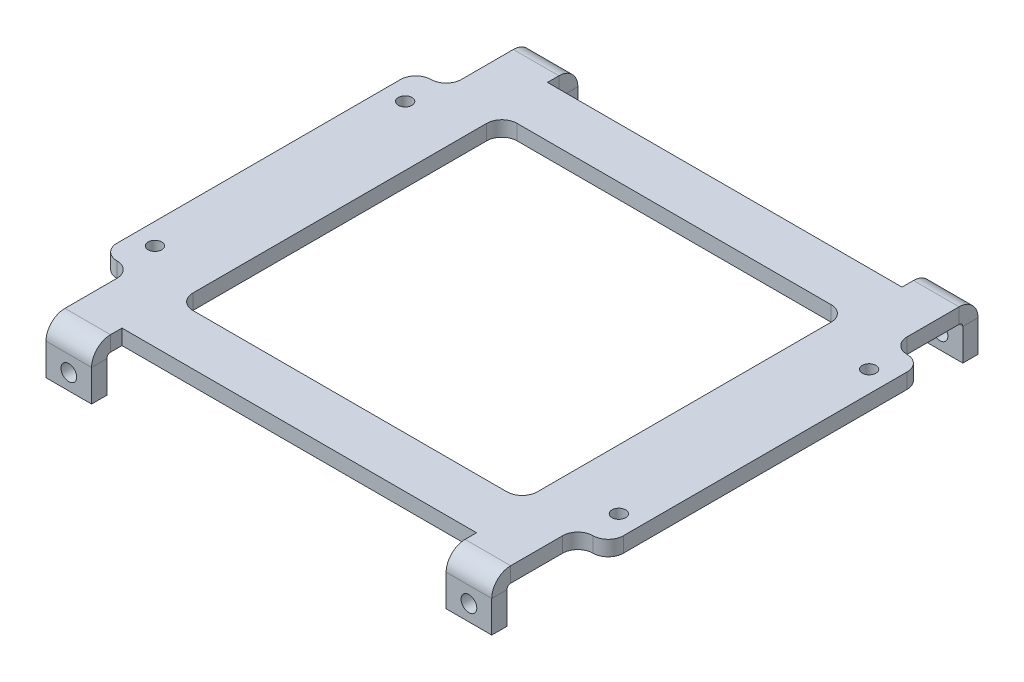
from build123d import *

# Parameters (mm, degrees)
SKETCH3_W                      = 68
SKETCH3_H                      = 64
BASE_FLANGE1_DEPTH             = 3
EDGE_FLANGE1_STRIP_W           = 13.4732
EDGE_FLANGE1_STRIP_H           = 3
EDGE_FLANGE1_STRIP_CUT_DEPTH   = 9
EDGE_FLANGE1_STRIP_2_W         = 13.4732
EDGE_FLANGE1_STRIP_2_H         = 3
EDGE_FLANGE1_STRIP_CUT_2_DEPTH = 9
EDGE_FLANGE1_STRIP_3_W         = 13.4732
EDGE_FLANGE1_STRIP_3_H         = 3
EDGE_FLANGE1_STRIP_CUT_3_DEPTH = 9
EDGE_FLANGE1_STRIP_4_W         = 13.4732
EDGE_FLANGE1_STRIP_4_H         = 3
EDGE_FLANGE1_STRIP_CUT_4_DEPTH = 9
EDGE_FLANGE1_DEPTH             = 9
EDGE_FLANGE1_BEND_DEPTH        = 9
EDGE_FLANGE1_BEND_2_DEPTH      = 9
EDGE_FLANGE1_BEND_3_DEPTH      = 9
FILLET1_R                      = 3
FILLET2_R                      = 3
SKETCH20_R                     = 1.55
CUT_EXTRUDE1_DEPTH             = 109.701425934
SKETCH22_R                     = 1.35
CUT_EXTRUDE2_DEPTH             = 71.0285656


# Sheet-metal steps are written as plain solids
with BuildPart() as part:
    # Sketch3 → Base-Flange1 (new body)
    with BuildSketch(Plane(origin=(0, 0, 0), x_dir=(1, 0, 0), z_dir=(0, 1, 0))):
        Polygon((50, 31), (44, 31), (44, 48), (35, 48), (35, 42), (-35, 42), (-35, 48), (-44, 48), (-44, 31), (-50, 31), (-50, -31), (-44, -31), (-44, -48), (-35, -48), (-35, -42), (35, -42), (35, -48), (44, -48), (44, -31), (50, -31), align=None)
        Rectangle(SKETCH3_W, SKETCH3_H, mode=Mode.SUBTRACT)
    extrude(amount=-BASE_FLANGE1_DEPTH)

    # Edge-Flange1 strip (across the edge) → Edge-Flange1 strip cut (cut)
    with BuildSketch(Plane(origin=(-35, -3, 48), x_dir=(0, 0, -1), z_dir=(-1, 0, 0))):
        with Locations((-3, -1.5)):
            Rectangle(EDGE_FLANGE1_STRIP_W, EDGE_FLANGE1_STRIP_H)
    extrude(amount=EDGE_FLANGE1_STRIP_CUT_DEPTH, mode=Mode.SUBTRACT)

    # Edge-Flange1 strip 2 (across the edge) → Edge-Flange1 strip cut 2 (cut)
    with BuildSketch(Plane(origin=(44, -3, 48), x_dir=(0, 0, -1), z_dir=(-1, 0, 0))):
        with Locations((-3, -1.5)):
            Rectangle(EDGE_FLANGE1_STRIP_2_W, EDGE_FLANGE1_STRIP_2_H)
    extrude(amount=EDGE_FLANGE1_STRIP_CUT_2_DEPTH, mode=Mode.SUBTRACT)

    # Edge-Flange1 strip 3 (across the edge) → Edge-Flange1 strip cut 3 (cut)
    with BuildSketch(Plane(origin=(35, -3, -48), x_dir=(0, 0, 1), z_dir=(1, 0, 0))):
        with Locations((-3, -1.5)):
            Rectangle(EDGE_FLANGE1_STRIP_3_W, EDGE_FLANGE1_STRIP_3_H)
    extrude(amount=EDGE_FLANGE1_STRIP_CUT_3_DEPTH, mode=Mode.SUBTRACT)

    # Edge-Flange1 strip 4 (across the edge) → Edge-Flange1 strip cut 4 (cut)
    with BuildSketch(Plane(origin=(-44, -3, -48), x_dir=(0, 0, 1), z_dir=(1, 0, 0))):
        with Locations((-3, -1.5)):
            Rectangle(EDGE_FLANGE1_STRIP_4_W, EDGE_FLANGE1_STRIP_4_H)
    extrude(amount=EDGE_FLANGE1_STRIP_CUT_4_DEPTH, mode=Mode.SUBTRACT)

    # Edge-Flange1 section (across the edge) → Edge-Flange1 (add)
    with BuildSketch(Plane(origin=(-35, -3, 48), x_dir=(0, 0, -1), z_dir=(-1, 0, 0))):
        with BuildLine():
            Line((0, 0.7366), (0, 7))
            Line((0, 7), (3, 7))
            Line((3, 7), (3, 0.7366))
            ThreePointArc((3, 0.7366), (3.215745145, 0.215745145), (3.7366, 0))
            Line((3.7366, 0), (3.7366, -3))
            ThreePointArc((3.7366, -3), (1.094424801, -1.905575199), (0, 0.7366))
        make_face()
    extrude(amount=EDGE_FLANGE1_DEPTH)

    # Edge-Flange1 section 2 (across the edge) → Edge-Flange1 bend (add)
    with BuildSketch(Plane(origin=(44, -3, 48), x_dir=(0, 0, -1), z_dir=(-1, 0, 0))):
        with BuildLine():
            Line((0, 0.7366), (0, 7))
            Line((0, 7), (3, 7))
            Line((3, 7), (3, 0.7366))
            ThreePointArc((3, 0.7366), (3.215745145, 0.215745145), (3.7366, 0))
            Line((3.7366, 0), (3.7366, -3))
            ThreePointArc((3.7366, -3), (1.094424801, -1.905575199), (0, 0.7366))
        make_face()
    extrude(amount=EDGE_FLANGE1_BEND_DEPTH)

    # Edge-Flange1 section 3 (across the edge) → Edge-Flange1 bend 2 (add)
    with BuildSketch(Plane(origin=(35, -3, -48), x_dir=(0, 0, 1), z_dir=(1, 0, 0))):
        with BuildLine():
            Line((0, 0.7366), (0, 7))
            Line((0, 7), (3, 7))
            Line((3, 7), (3, 0.7366))
            ThreePointArc((3, 0.7366), (3.215745145, 0.215745145), (3.7366, 0))
            Line((3.7366, 0), (3.7366, -3))
            ThreePointArc((3.7366, -3), (1.094424801, -1.905575199), (0, 0.7366))
        make_face()
    extrude(amount=EDGE_FLANGE1_BEND_2_DEPTH)

    # Edge-Flange1 section 4 (across the edge) → Edge-Flange1 bend 3 (add)
    with BuildSketch(Plane(origin=(-44, -3, -48), x_dir=(0, 0, 1), z_dir=(1, 0, 0))):
        with BuildLine():
            Line((0, 0.7366), (0, 7))
            Line((0, 7), (3, 7))
            Line((3, 7), (3, 0.7366))
            ThreePointArc((3, 0.7366), (3.215745145, 0.215745145), (3.7366, 0))
            Line((3.7366, 0), (3.7366, -3))
            ThreePointArc((3.7366, -3), (1.094424801, -1.905575199), (0, 0.7366))
        make_face()
    extrude(amount=EDGE_FLANGE1_BEND_3_DEPTH)

    # Fillet1
    fillet1_edges = [part.edges().sort_by_distance(p)[0] for p in [
        (44, -1.5, 31),
        (-44, -1.5, 31),
        (-44, -1.5, -31),
        (44, -1.5, -31),
        (-34, -1.5, 32),
        (-34, -1.5, -32),
        (34, -1.5, -32),
        (34, -1.5, 32),
    ]]
    fillet(fillet1_edges, radius=FILLET1_R)

    # Fillet2
    fillet2_edges = [part.edges().sort_by_distance(p)[0] for p in [
        (50, -1.5, -31),
        (50, -1.5, 31),
        (-50, -1.5, 31),
        (-50, -1.5, -31),
    ]]
    fillet(fillet2_edges, radius=FILLET2_R - 0.0001)  # a hair under: the kernel refuses the full size

    # Sketch20 → Cut-Extrude1 (cut, through all)
    with BuildSketch(Plane.XY.offset(48)):
        with Locations((-39.5, -6.8683)):
            Circle(SKETCH20_R)
        with Locations((39.5, -6.8683)):
            Circle(SKETCH20_R)
    extrude(amount=-CUT_EXTRUDE1_DEPTH, mode=Mode.SUBTRACT)

    # Sketch22 → Cut-Extrude2 (cut, through all)
    with BuildSketch(Plane(origin=(0, 0, 0), x_dir=(1, 0, 0), z_dir=(0, 1, 0))):
        with Locations(Location((-45.8, 24.7, 0), (0, 0, 270))):
            Circle(SKETCH22_R)
        with Locations(Location((-45.8, -24.7, 0), (0, 0, 270))):
            Circle(SKETCH22_R)
        with Locations(Location((45.8, 24.7, 0), (0, 0, 270))):
            Circle(SKETCH22_R)
        with Locations(Location((45.8, -24.7, 0), (0, 0, 270))):
            Circle(SKETCH22_R)
    extrude(amount=-CUT_EXTRUDE2_DEPTH, mode=Mode.SUBTRACT)


solid = part.part
